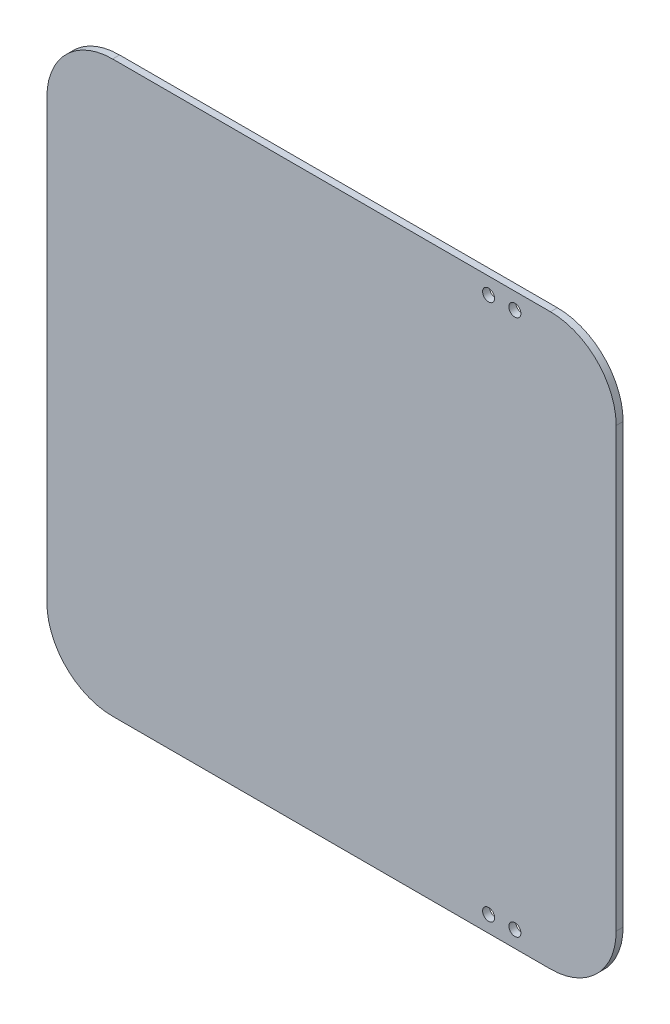
from build123d import *

# Parameters (mm, degrees)
BOSS_EXTRUDE1_DEPTH = 3.175
SKETCH2_R           = 2.75
CUT_EXTRUDE1_DEPTH  = 349.366795463


with BuildPart() as part:
    # Sketch1 → Boss-Extrude1 (new body)
    with BuildSketch(Plane.XY):
        with BuildLine():
            Line((79.71677043, 314.26787056), (-120.28322957, 314.26787056))
            ThreePointArc((-120.28322957, 314.26787056), (-141.496433005, 305.481073996), (-150.28322957, 284.26787056))
            Line((-150.28322957, 284.26787056), (-150.28322957, 84.26787056))
            ThreePointArc((-150.28322957, 84.26787056), (-141.496433005, 63.054667125), (-120.28322957, 54.26787056))
            Line((-120.28322957, 54.26787056), (79.71677043, 54.26787056))
            ThreePointArc((79.71677043, 54.26787056), (100.929973866, 63.054667125), (109.71677043, 84.26787056))
            Line((109.71677043, 84.26787056), (109.71677043, 284.26787056))
            ThreePointArc((109.71677043, 284.26787056), (100.929973866, 305.481073996), (79.71677043, 314.26787056))
        make_face()
    extrude(amount=-BOSS_EXTRUDE1_DEPTH)

    # Sketch2 → Cut-Extrude1 (cut, through all)
    with BuildSketch(Plane.XY):
        with Locations((51.46677043, 306.76787061)):
            Circle(SKETCH2_R)
        with Locations((63.46677043, 306.76787061)):
            Circle(SKETCH2_R)
        with Locations((63.46677043, 61.76787056)):
            Circle(SKETCH2_R)
        with Locations((51.46677043, 61.76787056)):
            Circle(SKETCH2_R)
    extrude(amount=-CUT_EXTRUDE1_DEPTH, mode=Mode.SUBTRACT)


solid = part.part
